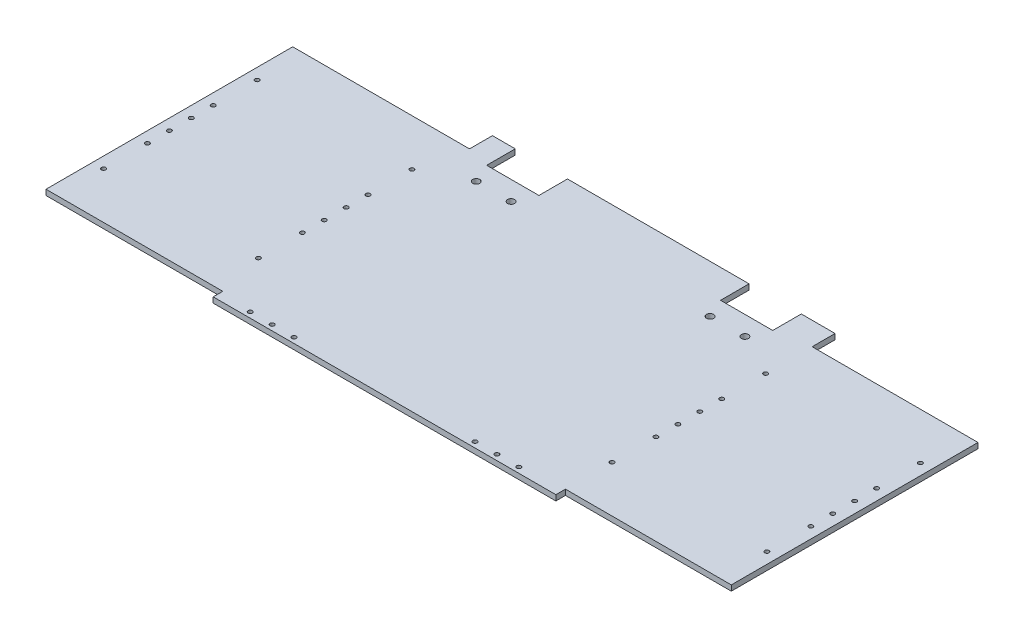
from build123d import *

# Parameters (mm, degrees)
SKETCH1_R           = 2.564
SKETCH1_R_2         = 1.55
BOSS_EXTRUDE1_DEPTH = 4


with BuildPart() as part:
    # Sketch1 → Boss-Extrude1 (new body)
    with BuildSketch(Plane(origin=(0, 0, 0), x_dir=(1, 0, 0), z_dir=(0, 1, 0))):
        Polygon((129, 0), (129, -7), (379, -7), (379, 0), (500, 0), (500, 180), (379, 180), (379, 196.718), (354.35, 196.718), (354.35, 175.89), (316.25, 175.89), (316.25, 196.718), (183.75, 196.718), (183.75, 175.89), (145.65, 175.89), (145.65, 196.718), (129, 196.718), (129, 180), (0, 180), (0, 0), align=None)
        with Locations((152, 161.92)):
            Circle(SKETCH1_R, mode=Mode.SUBTRACT)
        with Locations((177.4, 161.92)):
            Circle(SKETCH1_R, mode=Mode.SUBTRACT)
        with Locations((152, -3)):
            Circle(SKETCH1_R_2, mode=Mode.SUBTRACT)
        with Locations((184, -3)):
            Circle(SKETCH1_R_2, mode=Mode.SUBTRACT)
        with Locations((322.6, 161.92)):
            Circle(SKETCH1_R, mode=Mode.SUBTRACT)
        with Locations((348, 161.92)):
            Circle(SKETCH1_R, mode=Mode.SUBTRACT)
        with Locations((168, -3)):
            Circle(SKETCH1_R_2, mode=Mode.SUBTRACT)
        with Locations((316, -3)):
            Circle(SKETCH1_R_2, mode=Mode.SUBTRACT)
        with Locations((332, -3)):
            Circle(SKETCH1_R_2, mode=Mode.SUBTRACT)
        with Locations((348, -3)):
            Circle(SKETCH1_R_2, mode=Mode.SUBTRACT)
        with Locations((121, 146)):
            Circle(SKETCH1_R_2, mode=Mode.SUBTRACT)
        with Locations((121, 114)):
            Circle(SKETCH1_R_2, mode=Mode.SUBTRACT)
        with Locations((121, 98)):
            Circle(SKETCH1_R_2, mode=Mode.SUBTRACT)
        with Locations((121, 82)):
            Circle(SKETCH1_R_2, mode=Mode.SUBTRACT)
        with Locations((121, 66)):
            Circle(SKETCH1_R_2, mode=Mode.SUBTRACT)
        with Locations((121, 34)):
            Circle(SKETCH1_R_2, mode=Mode.SUBTRACT)
        with Locations((379, 146)):
            Circle(SKETCH1_R_2, mode=Mode.SUBTRACT)
        with Locations((379, 114)):
            Circle(SKETCH1_R_2, mode=Mode.SUBTRACT)
        with Locations((379, 98)):
            Circle(SKETCH1_R_2, mode=Mode.SUBTRACT)
        with Locations((379, 82)):
            Circle(SKETCH1_R_2, mode=Mode.SUBTRACT)
        with Locations((379, 66)):
            Circle(SKETCH1_R_2, mode=Mode.SUBTRACT)
        with Locations((379, 34)):
            Circle(SKETCH1_R_2, mode=Mode.SUBTRACT)
        with Locations((8, 146)):
            Circle(SKETCH1_R_2, mode=Mode.SUBTRACT)
        with Locations((8, 114)):
            Circle(SKETCH1_R_2, mode=Mode.SUBTRACT)
        with Locations((8, 98)):
            Circle(SKETCH1_R_2, mode=Mode.SUBTRACT)
        with Locations((8, 82)):
            Circle(SKETCH1_R_2, mode=Mode.SUBTRACT)
        with Locations((8, 66)):
            Circle(SKETCH1_R_2, mode=Mode.SUBTRACT)
        with Locations((8, 34)):
            Circle(SKETCH1_R_2, mode=Mode.SUBTRACT)
        with Locations((492, 34)):
            Circle(SKETCH1_R_2, mode=Mode.SUBTRACT)
        with Locations((492, 66)):
            Circle(SKETCH1_R_2, mode=Mode.SUBTRACT)
        with Locations((492, 82)):
            Circle(SKETCH1_R_2, mode=Mode.SUBTRACT)
        with Locations((492, 98)):
            Circle(SKETCH1_R_2, mode=Mode.SUBTRACT)
        with Locations((492, 114)):
            Circle(SKETCH1_R_2, mode=Mode.SUBTRACT)
        with Locations((492, 146)):
            Circle(SKETCH1_R_2, mode=Mode.SUBTRACT)
    extrude(amount=BOSS_EXTRUDE1_DEPTH)


solid = part.part
